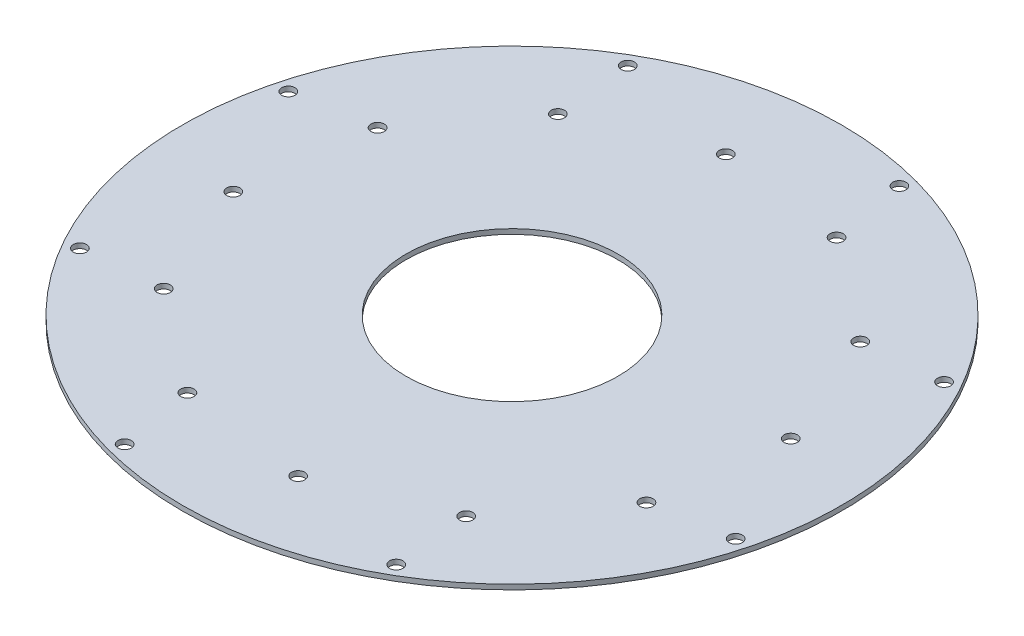
from build123d import *

# Parameters (mm, degrees)
SKETCH1_R                     = 99.5
SKETCH1_R_2                   = 32
BASE_DEPTH                    = 0.75
SKETCH2_R                     = 2
STRUCTURAL_HOLE_DEPTH         = 141.722244155
STRUCTURAL_HOLE_PATTERN_COUNT = 8
SKETCH3_R                     = 2
CUT_EXTRUDE1_DEPTH            = 141.722244155
CIRPATTERN1_COUNT             = 12


with BuildPart() as part:
    # Sketch1 → Base (new, symmetric)
    with BuildSketch(Plane(origin=(0, 0, 0), x_dir=(1, 0, 0), z_dir=(0, 1, 0))):
        Circle(SKETCH1_R)
        Circle(SKETCH1_R_2, mode=Mode.SUBTRACT)
    extrude(amount=BASE_DEPTH, both=True)

    # Sketch2 → Structural Hole (cut, through all)
    with BuildSketch(Plane(origin=(0, 0.75, 0), x_dir=(1, 0, 0), z_dir=(0, 1, 0))):
        with Locations((24.717218807, 92.245916411)):
            Circle(SKETCH2_R)
    structural_hole = extrude(amount=-STRUCTURAL_HOLE_DEPTH, mode=Mode.SUBTRACT)

    # Structural Hole Pattern: Structural Hole ×8 about axis
    structural_hole_pattern_axis = Axis((0, 0.75, 0), (0, -1, 0))
    for i in range(1, STRUCTURAL_HOLE_PATTERN_COUNT):
        add(structural_hole.rotate(structural_hole_pattern_axis, i * 360 / STRUCTURAL_HOLE_PATTERN_COUNT), mode=Mode.SUBTRACT)

    # Sketch3 → Cut-Extrude1 (cut, through all)
    with BuildSketch(Plane(origin=(0, 0.75, 0), x_dir=(1, 0, 0), z_dir=(0, 1, 0))):
        with Locations((-9.789464417, 74.358364603)):
            Circle(SKETCH3_R)
    cut_extrude1 = extrude(amount=-CUT_EXTRUDE1_DEPTH, mode=Mode.SUBTRACT)

    # CirPattern1: Cut-Extrude1 ×12 about axis
    cirpattern1_axis = Axis((0, 0.75, 0), (0, 1, 0))
    for i in range(1, CIRPATTERN1_COUNT):
        add(cut_extrude1.rotate(cirpattern1_axis, i * 360 / CIRPATTERN1_COUNT), mode=Mode.SUBTRACT)


solid = part.part
